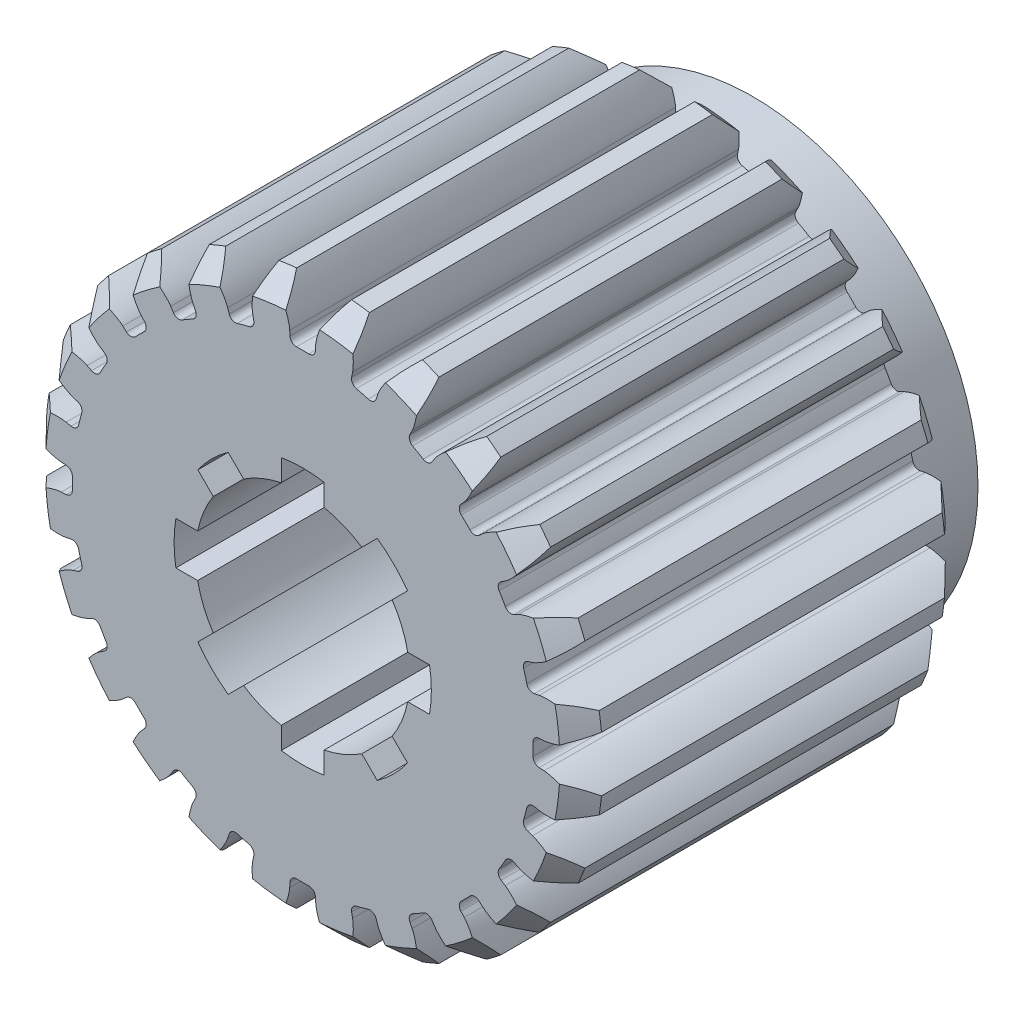
from build123d import *

# Parameters (mm, degrees)
SKETCH_1168_R                    = 13
EXTRUDE_1194_DEPTH               = 9
CHAMFER_1228_SIZE                = 1
CUT_EXTRUDE_1620_DEPTH           = 9
FILLET_2_R                       = 0.3
PATTERN_CIRCULAR_2_COUNT         = 24
FILLET_2_OF_PATTERN_CIRCULAR_2_R = 0.3
SKETCH_1_R                       = 10.5
EXTRUDE_1_DEPTH                  = 21
SKETCH_2_R                       = 5
CUT_EXTRUDE_1_DEPTH              = 28.85151481
CUT_EXTRUDE_2_DEPTH              = 28.85151481
PATTERN_CIRCULAR_1_COUNT         = 8


with BuildPart() as part:
    # Sketch 1168 → Extrude 1194 (new, symmetric)
    with BuildSketch(Plane.XY):
        Circle(SKETCH_1168_R)
    extrude(amount=EXTRUDE_1194_DEPTH, both=True)

    # Chamfer 1228
    chamfer_1228_edges = [part.edges().sort_by_distance(p)[0] for p in [
        (-13, 0, -9),
        (-13, 0, 9),
    ]]
    chamfer(chamfer_1228_edges, length=CHAMFER_1228_SIZE)

    # Sketch 1305 → Cut-Extrude 1620 (cut, symmetric)
    with BuildSketch(Plane.XY):
        with BuildLine():
            ThreePointArc((-0.577755701, 10.734463114), (0, 10.75), (0.577755701, 10.734463114))
            Line((0.577755701, 10.734463114), (0.606042161, 11.26001389))
            add(Edge.make_bspline(
                [(0.606042161, 11.26001389), (0.608396893, 11.30213014), (0.617035666, 11.38666051), (0.647695053, 11.546450302), (0.711401998, 11.777744999), (0.852520962, 12.167450238), (1.017815611, 12.500759184), (1.165932656, 12.75472372), (1.283185097, 12.936515605)],
                knots=[4.803e-05, 4.803e-05, 4.803e-05, 4.803e-05, 4.803e-05, 0.002802034, 0.005604068, 0.010661158, 0.015718248, 0.02985789, 0.02985789, 0.02985789, 0.02985789, 0.02985789], degree=4))
            ThreePointArc((1.283185097, 12.936515605), (0, 13), (-1.283185097, 12.936515605))
            add(Edge.make_bspline(
                [(-0.606042161, 11.26001389), (-0.608396893, 11.30213014), (-0.617035666, 11.38666051), (-0.647695053, 11.546450301), (-0.711401998, 11.777744999), (-0.852520962, 12.167450237), (-1.017815611, 12.500759184), (-1.165932656, 12.75472372), (-1.283185097, 12.936515605)],
                knots=[4.803e-05, 4.803e-05, 4.803e-05, 4.803e-05, 4.803e-05, 0.002802034, 0.005604068, 0.010661158, 0.015718248, 0.02985789, 0.02985789, 0.02985789, 0.02985789, 0.02985789], degree=4))
            Line((-0.606042161, 11.26001389), (-0.577755701, 10.734463114))
        make_face()
    cut_extrude_1620 = extrude(amount=CUT_EXTRUDE_1620_DEPTH, both=True, mode=Mode.SUBTRACT)

    # 圆角2
    fillet_2_edges = [part.edges().sort_by_distance(p)[0] for p in [
        (0.577755701, 10.734463114, 0),
        (-0.577755701, 10.734463114, 0),
    ]]
    fillet(fillet_2_edges, radius=FILLET_2_R)

    # 圆周阵列2: Cut-Extrude 1620 ×24 about axis
    pattern_circular_2_axis = Axis((0, 0, 9), (0, 0, -1))
    for i in range(1, PATTERN_CIRCULAR_2_COUNT):
        add(cut_extrude_1620.rotate(pattern_circular_2_axis, i * 360 / PATTERN_CIRCULAR_2_COUNT), mode=Mode.SUBTRACT)

    # 圆角2 of 圆周阵列2
    fillet_2_of_pattern_circular_2_edges = [part.edges().sort_by_distance(p)[0] for p in [
        (3.336352646, 10.219160974, 0),
        (2.22021434, 10.518229332, 0),
        (5.867582672, 9.007439902, 0),
        (4.866880442, 9.585195604, 0),
        (7.998946635, 7.181876686, 0),
        (7.181876686, 7.998946635, 0),
        (9.585195604, 4.866880442, 0),
        (9.007439902, 5.867582672, 0),
        (10.518229332, 2.22021434, 0),
        (10.219160974, 3.336352646, 0),
        (10.734463114, -0.577755701, 0),
        (10.734463114, 0.577755701, 0),
        (10.219160974, -3.336352646, 0),
        (10.518229332, -2.22021434, 0),
        (9.007439902, -5.867582672, 0),
        (9.585195604, -4.866880442, 0),
        (7.181876686, -7.998946635, 0),
        (7.998946635, -7.181876686, 0),
        (4.866880442, -9.585195604, 0),
        (5.867582672, -9.007439902, 0),
        (2.22021434, -10.518229332, 0),
        (3.336352646, -10.219160974, 0),
        (-0.577755701, -10.734463114, 0),
        (0.577755701, -10.734463114, 0),
        (-3.336352646, -10.219160974, 0),
        (-2.22021434, -10.518229332, 0),
        (-5.867582672, -9.007439902, 0),
        (-4.866880442, -9.585195604, 0),
        (-7.998946635, -7.181876686, 0),
        (-7.181876686, -7.998946635, 0),
        (-9.585195604, -4.866880442, 0),
        (-9.007439902, -5.867582672, 0),
        (-10.518229332, -2.22021434, 0),
        (-10.219160974, -3.336352646, 0),
        (-10.734463114, 0.577755701, 0),
        (-10.734463114, -0.577755701, 0),
        (-10.219160974, 3.336352646, 0),
        (-10.518229332, 2.22021434, 0),
        (-9.007439902, 5.867582672, 0),
        (-9.585195604, 4.866880442, 0),
        (-7.181876686, 7.998946635, 0),
        (-7.998946635, 7.181876686, 0),
        (-4.866880442, 9.585195604, 0),
        (-5.867582672, 9.007439902, 0),
        (-2.22021434, 10.518229332, 0),
        (-3.336352646, 10.219160974, 0),
    ]]
    fillet(fillet_2_of_pattern_circular_2_edges, radius=FILLET_2_OF_PATTERN_CIRCULAR_2_R)

    # 草图1 → 凸台-拉伸1 (add)
    with BuildSketch(Plane.XY.offset(9)):
        Circle(SKETCH_1_R)
    extrude(amount=-EXTRUDE_1_DEPTH)

    # 草图2 → 切除-拉伸1 (cut, through all)
    with BuildSketch(Plane.XY.offset(9)):
        Circle(SKETCH_2_R)
    extrude(amount=-CUT_EXTRUDE_1_DEPTH, mode=Mode.SUBTRACT)

    # 草图3 → 切除-拉伸2 (cut, through all)
    with BuildSketch(Plane.XY.offset(9)):
        with BuildLine():
            Line((1, -5.916079783), (1, 5.916079783))
            ThreePointArc((1, 5.916079783), (0, 6), (-1, 5.916079783))
            Line((-1, 5.916079783), (-1, -5.916079783))
            ThreePointArc((-1, -5.916079783), (0, -6), (1, -5.916079783))
        make_face()
    cut_extrude_2 = extrude(amount=-CUT_EXTRUDE_2_DEPTH, mode=Mode.SUBTRACT)

    # Pattern Circular 1: 切除-拉伸2 ×8 about axis
    pattern_circular_1_axis = Axis((0, 0, 9), (0, 0, 1))
    for i in range(1, PATTERN_CIRCULAR_1_COUNT):
        add(cut_extrude_2.rotate(pattern_circular_1_axis, i * 360 / PATTERN_CIRCULAR_1_COUNT), mode=Mode.SUBTRACT)


solid = part.part
